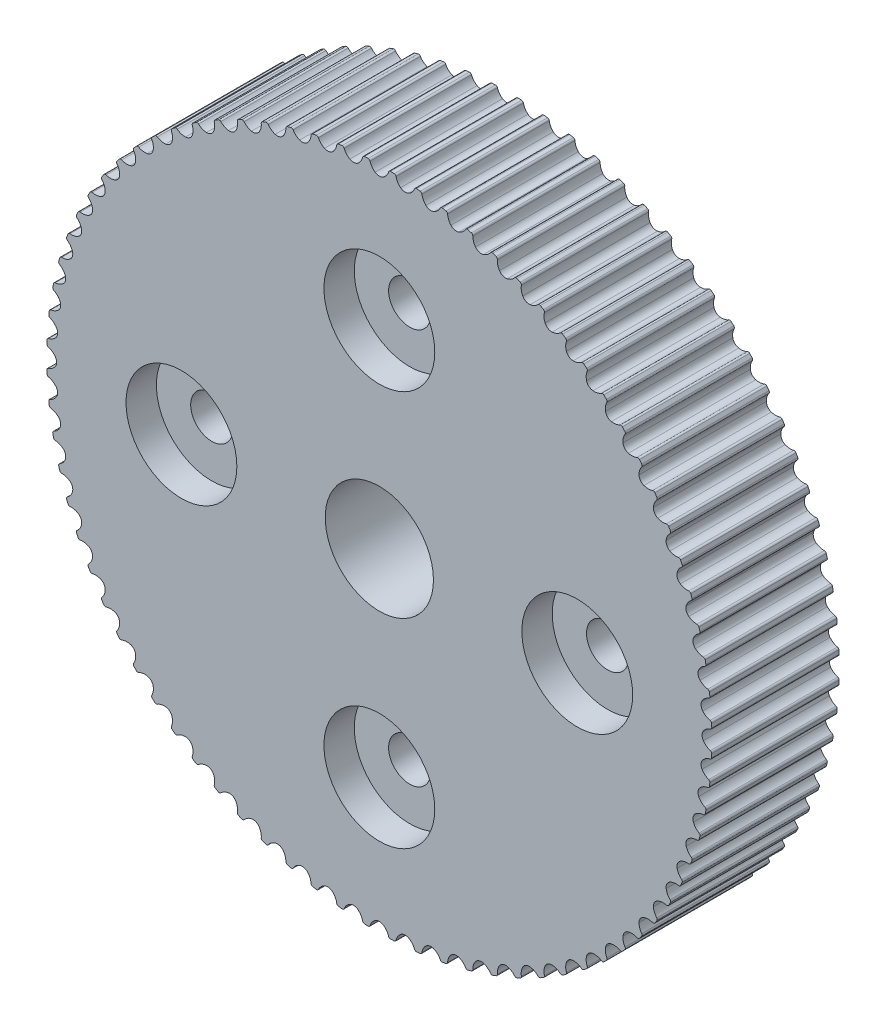
from build123d import *

# Parameters (mm, degrees)
CUT_EXTRUDE1_START                               = 0.125
CUT_EXTRUDE1_DEPTH                               = 38.027078607
CIRPATTERN1_COUNT                                = 80
SKETCH4_R                                        = 2.0828
CUT_EXTRUDE2_DEPTH                               = 37.88255206
CUT_EXTRUDE5_START                               = 9.4
SKETCH7_R                                        = 19.05
CUT_EXTRUDE5_DEPTH                               = 9.4
CBORE_FOR_M3_HEX_HEAD_MACHINE_SCREW1_D           = 3.2
CBORE_FOR_M3_HEX_HEAD_MACHINE_SCREW1_CBORE_D     = 8.4
CBORE_FOR_M3_HEX_HEAD_MACHINE_SCREW1_CBORE_DEPTH = 2.3


with BuildPart() as part:
    # Sketch2 → Revolve1 (revolve)
    with BuildSketch(Plane(origin=(0, 0, 0), x_dir=(0, 0, -1), z_dir=(1, 0, 0)), mode=Mode.PRIVATE) as revolve1_sk:
        Polygon((-9.525, 4.1), (9.525, 4.1), (9.525, 25.2095), (-0.125, 25.2095), (-0.125, 19.05), (-9.525, 19.05), align=None)
    revolve(revolve1_sk.sketch.rotate(Axis((0, 0, 9.525), (0, 0, -1)), 90), axis=Axis((0, 0, 9.525), (0, 0, -1)))

    # Sketch3 → Cut-Extrude1 (cut, through all)
    with BuildSketch(Plane.XY.offset(CUT_EXTRUDE1_START)):
        with BuildLine():
            Line((1.998425863, 25.130164829), (2.047001303, 25.741))
            Line((2.047001303, 25.741), (-2.047001303, 25.741))
            Line((-2.047001303, 25.741), (-1.998425863, 25.130164829))
            ThreePointArc((-1.998425863, 25.130164829), (-1.425226771, 25.169179941), (-0.851287437, 25.195122543))
            ThreePointArc((-0.851287437, 25.195122543), (-0.758961833, 25.167214793), (-0.702714921, 25.088862101))
            ThreePointArc((-0.702714921, 25.088862101), (-0.554430072, 24.791296599), (-0.316786517, 24.558790331))
            ThreePointArc((-0.316786517, 24.558790331), (0, 24.4595), (0.316786517, 24.558790331))
            ThreePointArc((0.316786517, 24.558790331), (0.554430072, 24.791296599), (0.702714921, 25.088862101))
            ThreePointArc((0.702714921, 25.088862101), (0.758961833, 25.167214793), (0.851287437, 25.195122543))
            ThreePointArc((0.851287437, 25.195122543), (1.425226771, 25.169179941), (1.998425863, 25.130164829))
        make_face()
    cut_extrude1 = extrude(amount=-CUT_EXTRUDE1_DEPTH, mode=Mode.SUBTRACT)

    # CirPattern1: Cut-Extrude1 ×80 about axis
    cirpattern1_axis = Axis((0, 0, 0), (0, 0, 1))
    for i in range(1, CIRPATTERN1_COUNT):
        add(cut_extrude1.rotate(cirpattern1_axis, i * 360 / CIRPATTERN1_COUNT), mode=Mode.SUBTRACT)

    # Sketch4 → Cut-Extrude2 (cut, through all)
    with BuildSketch(Plane(origin=(0, 0, 0), x_dir=(0, 0, -1), z_dir=(1, 0, 0))):
        with Locations(Location((-4.825, 0, 0), (0, 0, 180))):
            Circle(SKETCH4_R)
    extrude(amount=CUT_EXTRUDE2_DEPTH, mode=Mode.SUBTRACT)

    # Sketch7 → Cut-Extrude5 (cut)
    with BuildSketch(Plane.XY.offset(0.125).offset(CUT_EXTRUDE5_START)):
        Circle(SKETCH7_R)
    extrude(amount=-CUT_EXTRUDE5_DEPTH, mode=Mode.SUBTRACT)

    # CBORE for M3 Hex Head Machine Screw1 (through all)
    with Locations(Plane.XY.offset(0.125)):
        with Locations((0, -15), (0, 15), (-15, 0), (15, 0)):
            CounterBoreHole(CBORE_FOR_M3_HEX_HEAD_MACHINE_SCREW1_D / 2, CBORE_FOR_M3_HEX_HEAD_MACHINE_SCREW1_CBORE_D / 2, CBORE_FOR_M3_HEX_HEAD_MACHINE_SCREW1_CBORE_DEPTH)


solid = part.part
